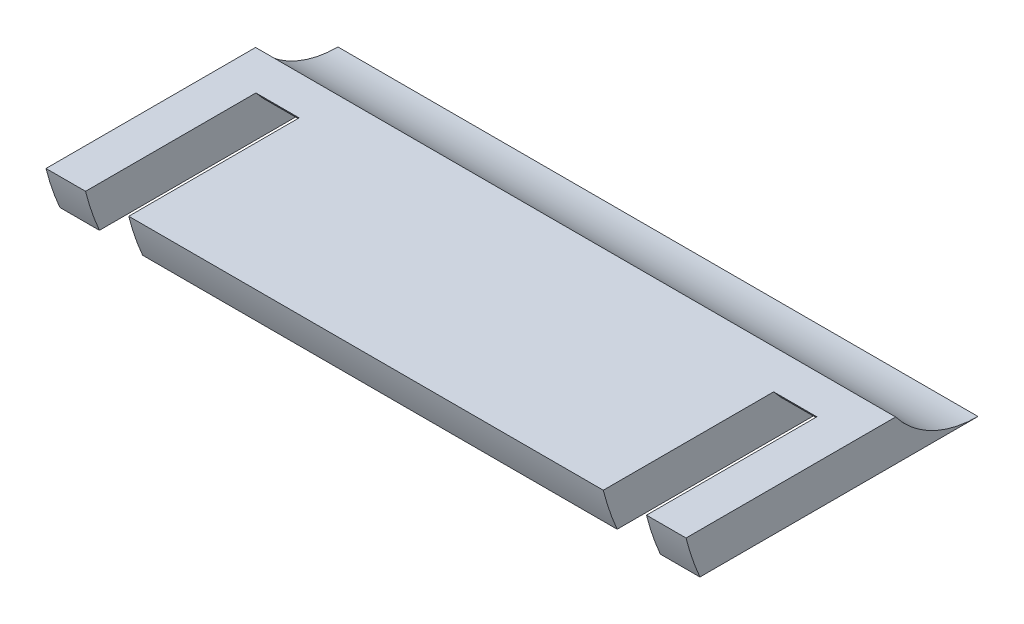
from build123d import *
from build123d.topology import SkipClean

# Parameters (mm, degrees)
BOSS_EXTRUDE1_DEPTH     = 5
BOSS_EXTRUDE2_START     = -39.25
BOSS_EXTRUDE2_DEPTH     = 78.5
CUT_EXTRUDE2_START      = 5.3
SKETCH4_R               = 31.757795359
SKETCH4_R_2             = 12.555236476
CUT_EXTRUDE2_DEPTH      = 5.3
CUT_EXTRUDE3_START      = -58.2
SKETCH4_2_R             = 31.757795359
SKETCH4_2_R_2           = 12.555236476
CUT_EXTRUDE3_DEPTH      = 5.3
CUT_EXTRUDE1_DEPTH      = 53.867491885
CUT_EXTRUDE1_DEPTH_BACK = 53.867491885
SKETCH3_R               = 12.705236476
BOSS_EXTRUDE3_START     = -34.4
BOSS_EXTRUDE3_DEPTH     = 68.8


# Read off the part's stored shape, not the designer's step: Boss-Extrude3
with BuildPart() as part:
    # Sketch1 → Boss-Extrude1 (new body)
    with BuildSketch(Plane(origin=(0, 0, 0), x_dir=(1, 0, 0), z_dir=(0, 1, 0))):
        Polygon((-39.25, 0), (39.25, 0), (39.25, -15.758241935), (34.4, -15.758241935), (34.4, -4.254055051), (29.1, -4.254055051), (29.1, -15.758241935), (-29.1, -15.758241935), (-29.1, -4.254055051), (-34.4, -4.254055051), (-34.4, -15.758241935), (-39.25, -15.758241935), align=None)
    extrude(amount=BOSS_EXTRUDE1_DEPTH)

    # Sketch2 → Boss-Extrude2 (add)
    with BuildSketch(Plane(origin=(0, 0, 0), x_dir=(0, 0, -1), z_dir=(1, 0, 0)).offset(BOSS_EXTRUDE2_START)):
        with BuildLine():
            ThreePointArc((-4.254055051, 0), (-9.889930421, 1.318404488), (-14.356152099, 5))
            Line((-14.356152099, 5), (-35.062931969, 5))
            ThreePointArc((-35.062931969, 5), (-34.315415728, 2.464525546), (-33.359630671, 0))
            Line((-33.359630671, 0), (-4.254055051, 0))
        make_face()
        with BuildLine():
            ThreePointArc((-1.754055051, 0.248389607), (-5.988122383, 1.931408415), (-9.356152099, 5))
            Line((-9.356152099, 5), (-14.356152099, 5))
            ThreePointArc((-14.356152099, 5), (-9.889930421, 1.318404488), (-4.254055051, 0))
            ThreePointArc((-4.254055051, 0), (-2.997900463, 0.0622499), (-1.754055051, 0.248389607))
        make_face()
        with BuildLine():
            ThreePointArc((0.745944949, 0), (-0.510209639, 0.0622499), (-1.754055051, 0.248389607))
            ThreePointArc((-1.754055051, 0.248389607), (-2.997900463, 0.0622499), (-4.254055051, 0))
            Line((-4.254055051, 0), (0, 0))
            Line((0, 0), (0.745944949, 0))
        make_face()
    extrude(amount=BOSS_EXTRUDE2_DEPTH)

    # Sketch4 → Cut-Extrude2 (cut)
    with BuildSketch(Plane.ZY.offset(29.1).offset(CUT_EXTRUDE2_START)):
        with Locations((4.254055051, 12.705236476)):
            Circle(SKETCH4_R)
        with Locations((4.254055051, 12.705236476)):
            Circle(SKETCH4_R_2, mode=Mode.SUBTRACT)
    extrude(amount=-CUT_EXTRUDE2_DEPTH, mode=Mode.SUBTRACT)

    # Sketch4<2> → Cut-Extrude3 (cut)
    with BuildSketch(Plane.ZY.offset(29.1).offset(CUT_EXTRUDE3_START)):
        with Locations((4.254055051, 12.705236476)):
            Circle(SKETCH4_2_R)
        with Locations((4.254055051, 12.705236476)):
            Circle(SKETCH4_2_R_2, mode=Mode.SUBTRACT)
    extrude(amount=-CUT_EXTRUDE3_DEPTH, mode=Mode.SUBTRACT)

    # Sketch3 → Cut-Extrude1 (cut, two sides: drawn at the far end of the back side and taken through both)
    with SkipClean():  # the faces are left unmerged after this step: merging them gives an invalid solid
        with BuildSketch(Plane(origin=(0, 0, 0), x_dir=(0, 0, -1), z_dir=(1, 0, 0)).offset(-CUT_EXTRUDE1_DEPTH_BACK)):
            with Locations((0.745944949, 12.705236476)):
                Circle(SKETCH3_R)
        extrude(amount=CUT_EXTRUDE1_DEPTH + CUT_EXTRUDE1_DEPTH_BACK, mode=Mode.SUBTRACT)

    # Boss-Extrude3 outline → Boss-Extrude3 (add)
    with SkipClean():  # the faces are left unmerged after this step: merging them gives an invalid solid
        with BuildSketch(Plane(origin=(0, 0, 0), x_dir=(0, 0, -1), z_dir=(1, 0, 0)).offset(BOSS_EXTRUDE3_START)):
            with BuildLine():
                Line((-4.254055051, 0), (0.745944949, 0))
                ThreePointArc((0.745944949, 0), (-0.702961041, 0.082887038), (-2.132962145, 0.330466666))
                ThreePointArc((-2.132962145, 0.330466666), (-3.189676907, 0.195198022), (-4.254055051, 0.15))
                Line((-4.254055051, 0.15), (-4.254055051, 0))
            make_face()
        extrude(amount=BOSS_EXTRUDE3_DEPTH)


solid = part.part
